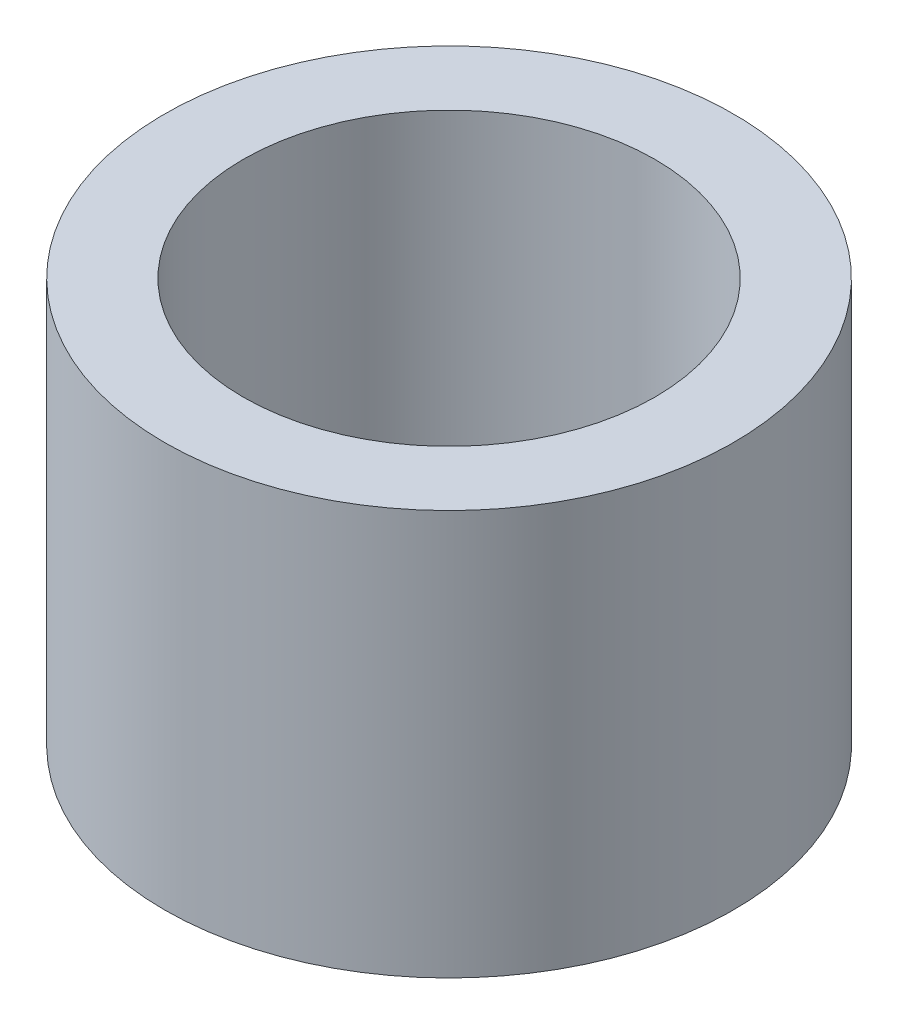
from build123d import *

# Parameters (mm, degrees)
SKETCH1_R           = 22.5
BOSS_EXTRUDE1_DEPTH = 32.011079226
SKETCH2_R           = 16.283005279
CUT_EXTRUDE1_DEPTH  = 46.135453839


with BuildPart() as part:
    # Sketch1 → Boss-Extrude1 (new body)
    with BuildSketch(Plane(origin=(0, 0, 0), x_dir=(1, 0, 0), z_dir=(0, 1, 0))):
        Circle(SKETCH1_R)
    extrude(amount=BOSS_EXTRUDE1_DEPTH)

    # Sketch2 → Cut-Extrude1 (cut, through all)
    with BuildSketch(Plane(origin=(0, 0, 0), x_dir=(1, 0, 0), z_dir=(0, 1, 0))):
        Circle(SKETCH2_R)
    extrude(amount=CUT_EXTRUDE1_DEPTH, mode=Mode.SUBTRACT)


solid = part.part
